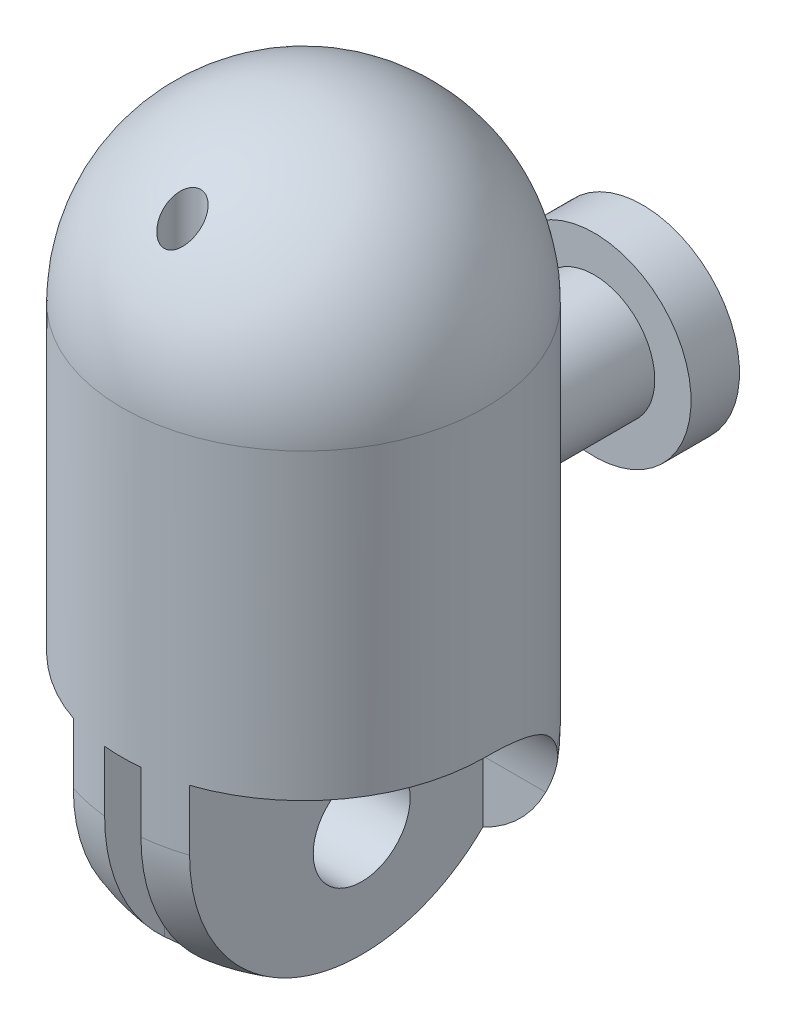
from build123d import *

# Parameters (mm, degrees)
SKETCH1_R               = 7.5
SKETCH1_R_2             = 0.75
BOSS_EXTRUDE1_DEPTH     = 30
FILLET4_R               = 7.5
SKETCH2_W               = 3.090169944
SKETCH2_H               = 10
BOSS_EXTRUDE2_DEPTH     = 20
SKETCH3_R               = 2
CUT_EXTRUDE1_DEPTH      = 45.300112867
CUT_EXTRUDE4_START      = -45.300113002
SKETCH7_R               = 2
CUT_EXTRUDE4_DEPTH      = 45.400113002
CUT_EXTRUDE5_DEPTH      = 45.300113002
CUT_EXTRUDE5_DEPTH_BACK = 45.300113002
SKETCH7_2_R             = 2
CUT_EXTRUDE8_REACH      = 46.3
SKETCH15_R              = 2.5
BOSS_EXTRUDE3_DEPTH     = 12
SKETCH16_R              = 4
BOSS_EXTRUDE4_DEPTH     = 2
SKETCH13_W              = 1.5
SKETCH13_H              = 8.04181095
CUT_EXTRUDE14_DEPTH     = 48.154003117
SKETCH10_R              = 7.5
CUT_EXTRUDE11_DEPTH     = 28.540878735
REVOLVE1_ANGLE          = 180
SKETCH1_2_R             = 0.75
CUT_EXTRUDE12_DEPTH     = 34.944808167
CUT_EXTRUDE16_DEPTH     = 2


with BuildPart() as part:
    # Sketch1 → Boss-Extrude1 (new body)
    with BuildSketch(Plane(origin=(0, 0, 0), x_dir=(1, 0, 0), z_dir=(0, 1, 0))):
        with Locations(Location((0, 0, 0), (0, 0, 270))):
            Circle(SKETCH1_R)
        with Locations(Location((0, -5, 0), (0, 0, 270))):
            Circle(SKETCH1_R_2, mode=Mode.SUBTRACT)
    extrude(amount=BOSS_EXTRUDE1_DEPTH)

    # Fillet4
    # the kernel refuses this fillet: 7.5 mm, written as the material it takes off along each edge
    with BuildSketch(Plane(origin=(0, 0, 0), x_dir=(0, 0, 1), z_dir=(-1, 0, 0))) as fillet4_piece_1:
        with BuildLine():
            CenterArc((7.5 - FILLET4_R, FILLET4_R), FILLET4_R, 270, 90)
            Line((7.5 - FILLET4_R, 0), (7.5, 0))
            Line((7.5, 0), (7.5, FILLET4_R))
        make_face()
    revolve(axis=Axis((0, 0, 0), (0, 1, 0)), mode=Mode.SUBTRACT)
    with BuildSketch(Plane(origin=(0, 30, 0), x_dir=(0, 0, 1), z_dir=(-1, 0, 0))) as fillet4_piece_2:
        with BuildLine():
            CenterArc((7.5 - FILLET4_R, -FILLET4_R), FILLET4_R, 0, 90)
            Line((7.5 - FILLET4_R, 0), (7.5, 0))
            Line((7.5, 0), (7.5, -FILLET4_R))
        make_face()
    revolve(axis=Axis((0, 30, 0), (0, 1, 0)), mode=Mode.SUBTRACT)

    # Sketch2 → Boss-Extrude2 (add)
    with BuildSketch(Plane(origin=(0, 22.5, 0), x_dir=(1, 0, 0), z_dir=(0, 1, 0))):
        with Locations((4.045084972, 0)):
            Rectangle(SKETCH2_W, SKETCH2_H)
        with BuildLine():
            ThreePointArc((5.590169944, -5), (7.5, 0), (5.590169944, 5))
            Line((5.590169944, 5), (5.590169944, -5))
        make_face()
    boss_extrude2 = extrude(amount=BOSS_EXTRUDE2_DEPTH)

    # Sketch3 → Cut-Extrude1 (cut, symmetric)
    with BuildSketch(Plane.ZY.offset(-2.5)):
        with BuildLine():
            ThreePointArc((-5, 37.5), (-3.535533906, 41.035533906), (0, 42.5))
            Line((0, 42.5), (-5, 42.5))
            Line((-5, 42.5), (-5, 37.5))
        make_face()
        with BuildLine():
            ThreePointArc((0, 42.5), (3.535533906, 41.035533906), (5, 37.5))
            Line((5, 37.5), (5, 42.5))
            Line((5, 42.5), (0, 42.5))
        make_face()
        with Locations(Location((0, 37.5, 0), (0, 0, 270))):
            Circle(SKETCH3_R)
    cut_extrude1 = extrude(amount=CUT_EXTRUDE1_DEPTH, both=True, mode=Mode.SUBTRACT)

    # Sketch7 → Cut-Extrude4 (cut)
    with BuildSketch(Plane.ZY.offset(-2.5).offset(CUT_EXTRUDE4_START)):
        with BuildLine():
            Line((0, 10), (7.5, 10))
            Line((7.5, 10), (7.5, 0))
            Line((7.5, 0), (-5, 0))
            Line((-5, 0), (-5, 5))
            ThreePointArc((-5, 5), (-3.535533906, 8.535533906), (0, 10))
        make_face()
        with Locations(Location((0, 5, 0), (0, 0, 230.136383732))):
            Circle(SKETCH7_R, mode=Mode.SUBTRACT)
    cut_extrude4 = extrude(amount=CUT_EXTRUDE4_DEPTH, mode=Mode.SUBTRACT)

    # Sketch7<2> → Cut-Extrude5 (cut, two sides: drawn at the far end of the back side and taken through both)
    with BuildSketch(Plane.ZY.offset(-2.5).offset(-CUT_EXTRUDE5_DEPTH_BACK)):
        with Locations(Location((0, 5, 0), (0, 0, 222.357273293))):
            Circle(SKETCH7_2_R)
    extrude(amount=CUT_EXTRUDE5_DEPTH + CUT_EXTRUDE5_DEPTH_BACK, mode=Mode.SUBTRACT)

    # Mirror1: Boss-Extrude2, Cut-Extrude1, Cut-Extrude4 across plane
    add(boss_extrude2.mirror(Plane(origin=(0, 0, 0), x_dir=(0, 0, 1), z_dir=(1, 0, 0))))
    add(cut_extrude1.mirror(Plane(origin=(0, 0, 0), x_dir=(0, 0, 1), z_dir=(1, 0, 0))), mode=Mode.SUBTRACT)
    add(cut_extrude4.mirror(Plane(origin=(0, 0, 0), x_dir=(0, 0, 1), z_dir=(1, 0, 0))), mode=Mode.SUBTRACT)

    # Cut-Extrude8: up to this face of the body (flat: up to its plane)
    cut_extrude8_end = Plane(part.part.faces().sort_by_distance((-2.5, 34.956709536, 0))[0])
    # Sketch9 → Cut-Extrude8 (cut, up to the picked face)
    with BuildSketch(Plane.ZY.offset(-2.5), mode=Mode.PRIVATE) as cut_extrude8_sk1:
        with BuildLine():
            Line((5, 27.5), (22.867472592, 27.5))
            Line((22.867472592, 27.5), (22.867472592, 37.5))
            Line((22.867472592, 37.5), (-5, 37.5))
            ThreePointArc((-5, 37.5), (-2.071067812, 30.428932188), (5, 27.5))
        make_face()
    cut_extrude8_tool1 = split(extrude(cut_extrude8_sk1.sketch, amount=CUT_EXTRUDE8_REACH, mode=Mode.PRIVATE), bisect_by=cut_extrude8_end, keep=Keep.BOTH, mode=Mode.PRIVATE)
    add(cut_extrude8_tool1.solids().sort_by(Axis((2.5, 32.730802, 9.909907), (-1, 0, 0)))[0], mode=Mode.SUBTRACT)

    # Sketch15 → Boss-Extrude3 (add)
    with BuildSketch(Plane.XY):
        with Locations((0, 15)):
            Circle(SKETCH15_R)
    extrude(amount=-BOSS_EXTRUDE3_DEPTH)

    # Sketch16 → Boss-Extrude4 (add)
    with BuildSketch(Plane(origin=(0, 0, -12), x_dir=(-1, 0, 0), z_dir=(0, 0, -1))):
        with Locations((0, 15)):
            Circle(SKETCH16_R)
    extrude(amount=BOSS_EXTRUDE4_DEPTH)

    # Sketch13 → Cut-Extrude14 (cut, through all)
    with BuildSketch(Plane.XY.offset(5)):
        with Locations((-1.855e-06, 5.979094525)):
            Rectangle(SKETCH13_W, SKETCH13_H)
    extrude(amount=CUT_EXTRUDE14_DEPTH, mode=Mode.SUBTRACT)

    # Sketch10 → Cut-Extrude11 (cut, through all)
    with BuildSketch(Plane(origin=(0, 22.5, 0), x_dir=(1, 0, 0), z_dir=(0, 1, 0))):
        with Locations(Location((0, 0, 0), (0, 0, 90))):
            Circle(SKETCH10_R)
    extrude(amount=CUT_EXTRUDE11_DEPTH, mode=Mode.SUBTRACT)

    # Sketch11 → Revolve1 (revolve)
    with BuildSketch(Plane(origin=(0, 22.5, 0), x_dir=(1, 0, 0), z_dir=(0, 1, 0))):
        with BuildLine():
            Line((0, 7.5), (0, -7.5))
            ThreePointArc((0, -7.5), (7.5, 0), (0, 7.5))
        make_face()
    revolve(axis=Axis((0, 22.5, -7.5), (0, 0, 1)), revolution_arc=REVOLVE1_ANGLE)

    # Sketch1<2> → Cut-Extrude12 (cut, through all)
    with BuildSketch(Plane(origin=(0, 0, 0), x_dir=(1, 0, 0), z_dir=(0, 1, 0))):
        with Locations(Location((0, -5, 0), (0, 0, 156.648060809))):
            Circle(SKETCH1_2_R)
    extrude(amount=CUT_EXTRUDE12_DEPTH, mode=Mode.SUBTRACT)

    # Sketch14<2> → Cut-Extrude16 (cut, symmetric)
    with BuildSketch(Plane(origin=(0, 0, 0), x_dir=(0, 0, -1), z_dir=(1, 0, 0))):
        Polygon((7.5, 1.909830056), (7.5, 13.090169944), (7.181694991, 15), (5, 1.909830056), align=None)
    extrude(amount=CUT_EXTRUDE16_DEPTH, both=True, mode=Mode.SUBTRACT)


solid = part.part
